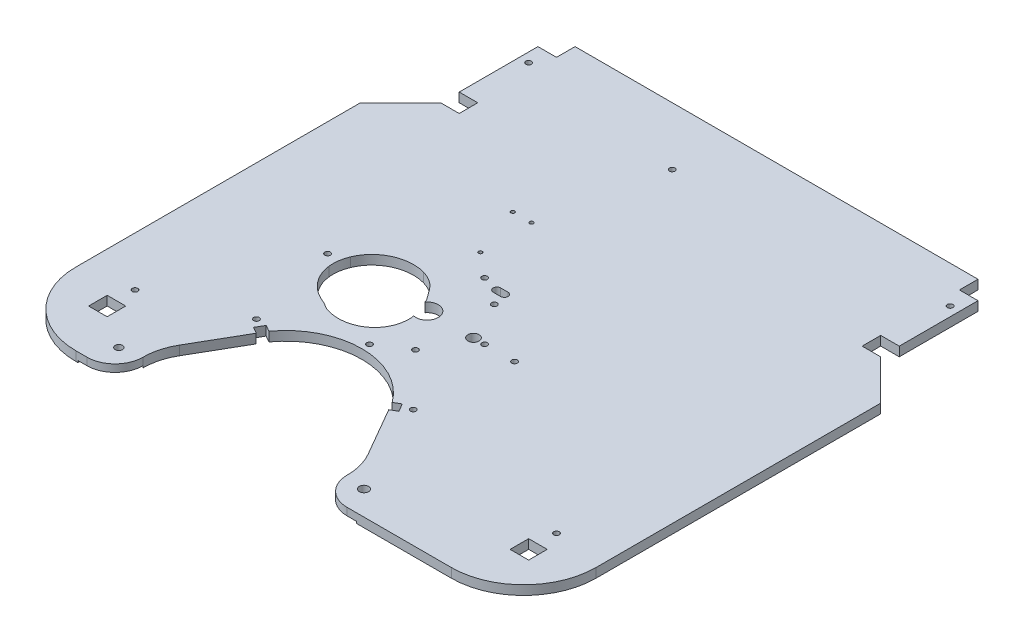
from build123d import *

# Parameters (mm, degrees)
ESQUISSE1_W              = 280.2
ESQUISSE1_H              = 276.282873123
BOSS_EXTRU_1_DEPTH       = 5
ESQUISSE2_R              = 1.5
ENL_V_MAT_EXTRU_2_DEPTH  = 283.344868376
ENL_V_MAT_EXTRU_3_DEPTH  = 283.344868376
ESQUISSE4_R              = 1
ENL_V_MAT_EXTRU_4_DEPTH  = 283.344868514
ESQUISSE5_R              = 1.5
ESQUISSE5_R_2            = 3
ENL_V_MAT_EXTRU_5_DEPTH  = 283.344868514
ESQUISSE6_R              = 6
ENL_V_MAT_EXTRU_6_DEPTH  = 283.344868514
ENL_V_MAT_EXTRU_7_DEPTH  = 283.344868514
ENL_V_MAT_EXTRU_8_DEPTH  = 283.344868514
ENL_V_MAT_EXTRU_9_DEPTH  = 283.344868514
ENL_V_MAT_EXTRU_10_DEPTH = 1
ESQUISSE11_W             = 10
ESQUISSE11_H             = 10
ENL_V_MAT_EXTRU_11_DEPTH = 283.344868514
ESQUISSE12_R             = 2.5
ESQUISSE12_R_2           = 2
ENL_V_MAT_EXTRU_12_DEPTH = 283.344868514
ESQUISSE13_R             = 1.5
ENL_V_MAT_EXTRU_15_DEPTH = 283.344868514


with BuildPart() as part:
    # Esquisse1 → Boss.-Extru.1 (new body)
    with BuildSketch(Plane(origin=(0, 0, 0), x_dir=(1, 0, 0), z_dir=(0, 1, 0))):
        with Locations((0, -106.941436562)):
            Rectangle(ESQUISSE1_W, ESQUISSE1_H)
    extrude(amount=BOSS_EXTRU_1_DEPTH)

    # Esquisse2 → Enlèv. mat.-Extru.2 (cut, through all)
    with BuildSketch(Plane(origin=(0, 0, 0), x_dir=(1, 0, 0), z_dir=(0, 1, 0))):
        with Locations((-67.225778058, -181.665063509)):
            Circle(ESQUISSE2_R)
        with Locations((17.225778058, -181.665063509)):
            Circle(ESQUISSE2_R)
        with BuildLine():
            Line((-58.181549424, -184), (-61.645651039, -182))
            Line((-61.645651039, -182), (-64.145651039, -186.330127019))
            Line((-64.145651039, -186.330127019), (-60.681549424, -188.330127019))
            Line((-60.681549424, -188.330127019), (-75.853895909, -214.609402001))
            ThreePointArc((-75.853895909, -214.609402001), (-78.945508514, -222.073215083), (-80, -230.082873123))
            ThreePointArc((-80, -230.082873123), (-84.393398282, -240.68947484), (-95, -245.082873123))
            Line((-95, -245.082873123), (45, -245.082873123))
            ThreePointArc((45, -245.082873123), (34.393398282, -240.68947484), (30, -230.082873123))
            ThreePointArc((30, -230.082873123), (28.945508514, -222.073215083), (25.853895909, -214.609402001))
            Line((25.853895909, -214.609402001), (10.681549424, -188.330127019))
            Line((10.681549424, -188.330127019), (14.145651039, -186.330127019))
            Line((14.145651039, -186.330127019), (11.645651039, -182))
            Line((11.645651039, -182), (8.181549424, -184))
            ThreePointArc((8.181549424, -184), (-25, -167.082873123), (-58.181549424, -184))
        make_face()
    extrude(amount=ENL_V_MAT_EXTRU_2_DEPTH, mode=Mode.SUBTRACT)

    # Esquisse3 → Enlèv. mat.-Extru.3 (cut, through all)
    with BuildSketch(Plane(origin=(0, 5, 0), x_dir=(1, 0, 0), z_dir=(0, 1, 0))):
        with BuildLine():
            Line((-30.232196293, -127.056876517), (-26.124706917, -139.131217425))
            add(Edge.make_bspline(
                [(-26.124706917, -139.131217425), (-25.973443286, -141.562315427), (-26.240501714, -144.066449507), (-26.974458359, -146.389039833)],
                knots=[0, 0, 0, 0, 1, 1, 1, 1], degree=3))
            add(Edge.make_bspline(
                [(-26.974458359, -146.389039833), (-27.240939918, -147.232315109), (-27.901711614, -148.887186594), (-29.222092456, -151.16859082), (-30.896145941, -153.271950606), (-32.173925278, -154.467879681), (-32.85436264, -155.020953925)],
                knots=[0, 0, 0, 0, 0.25, 0.5, 0.75, 1, 1, 1, 1], degree=3))
            add(Edge.make_bspline(
                [(-32.85436264, -155.020953925), (-34.102216947, -156.035236967), (-36.895257319, -157.732816873), (-39.966969366, -158.683613706), (-41.535872906, -158.982350321)],
                knots=[0, 0, 0, 0, 0.5, 1, 1, 1, 1], degree=3))
            add(Edge.make_bspline(
                [(-41.535872906, -158.982350321), (-44.13944429, -159.478099156), (-46.882867983, -159.47574722), (-49.48692049, -158.982531853)],
                knots=[0, 0, 0, 0, 1, 1, 1, 1], degree=3))
            add(Edge.make_bspline(
                [(-49.48692049, -158.982531853), (-49.973436213, -158.890384314), (-50.941516847, -158.671807697), (-52.005577298, -158.352188131), (-52.710739171, -158.106116095), (-53.049063692, -157.981027978), (-53.432325993, -157.83427396), (-53.839616411, -157.629085383), (-54.162137671, -157.444280488), (-54.493584438, -157.24405871), (-54.822631153, -157.027085358), (-55.019194439, -156.890401704), (-55.119773387, -156.820266925)],
                knots=[0, 0, 0, 0, 0.25, 0.5, 0.5625, 0.625, 0.6875, 0.75, 0.8125, 0.875, 0.9375, 1, 1, 1, 1], degree=3))
            add(Edge.make_bspline(
                [(-55.119773387, -156.820266925), (-55.342584678, -156.664898224), (-55.821161133, -156.320773011), (-56.357830194, -156.028764531), (-57.135810805, -155.694321533), (-58.127753562, -155.272422312), (-59.441462171, -154.713730904), (-60.715247509, -154.070015017), (-61.736091579, -153.463400683), (-62.671055675, -152.853125374), (-64.3254583, -151.704430932), (-66.461253558, -149.797913164), (-68.688909234, -147.123366593), (-71.04573381, -143.184617989), (-72.065572969, -139.797016013), (-72.336044542, -137.516218816)],
                knots=[0, 0, 0, 0, 0.03125, 0.0625, 0.09375, 0.125, 0.1875, 0.25, 0.28125, 0.3125, 0.375, 0.5, 0.625, 0.75, 1, 1, 1, 1], degree=3))
            add(Edge.make_bspline(
                [(-72.336044542, -137.516218816), (-72.538851292, -135.806016663), (-72.497059046, -132.31446777), (-71.577583293, -128.96502082), (-70.925114795, -127.375270768)],
                knots=[0, 0, 0, 0, 0.5, 1, 1, 1, 1], degree=3))
            add(Edge.make_bspline(
                [(-70.925114795, -127.375270768), (-70.413093619, -126.127722888), (-69.152455528, -123.733716988), (-66.576150351, -120.520293649), (-63.491201583, -117.918915096), (-59.929943003, -115.889711454), (-56.128151034, -114.553617023), (-52.09810731, -113.890404675), (-48.046815493, -113.938774256), (-45.377232563, -114.445148274), (-44.081266578, -114.817883607)],
                knots=[0, 0, 0, 0, 0.125, 0.25, 0.375, 0.5, 0.625, 0.75, 0.875, 1, 1, 1, 1], degree=3))
            add(Edge.make_bspline(
                [(-44.081266578, -114.817883607), (-43.14238246, -115.087917919), (-41.310567547, -115.747973194), (-39.103484983, -116.93355719), (-37.482075864, -118.081051527), (-36.310697029, -119.096824351), (-35.307582377, -120.188793074), (-34.695859436, -120.936019919), (-34.39519288, -121.317167086)],
                knots=[0, 0, 0, 0, 0.25, 0.5, 0.625, 0.75, 0.875, 1, 1, 1, 1], degree=3))
            add(Edge.make_bspline(
                [(-34.39519288, -121.317167086), (-33.6647314, -122.243154093), (-32.610141308, -123.682254904), (-31.253536633, -125.564961028), (-30.556455375, -126.553796492), (-30.232196293, -127.056876517)],
                knots=[0, 0, 0, 0, 0.5, 0.75, 1, 1, 1, 1], degree=3))
        make_face()
    extrude(amount=-ENL_V_MAT_EXTRU_3_DEPTH, mode=Mode.SUBTRACT)

    # Esquisse4 → Enlèv. mat.-Extru.4 (cut, through all)
    with BuildSketch(Plane(origin=(0, 5, 0), x_dir=(1, 0, 0), z_dir=(0, 1, 0))):
        with Locations((-48.2, -62.65)):
            Circle(ESQUISSE4_R)
        with Locations((-38.1, -62.65)):
            Circle(ESQUISSE4_R)
        with Locations((-38.1, -90.25)):
            Circle(ESQUISSE4_R)
    extrude(amount=-ENL_V_MAT_EXTRU_4_DEPTH, mode=Mode.SUBTRACT)

    # Esquisse5 → Enlèv. mat.-Extru.5 (cut, through all)
    with BuildSketch(Plane(origin=(0, 5, 0), x_dir=(1, 0, 0), z_dir=(0, 1, 0))):
        with Locations((22.122359024, -132)):
            Circle(ESQUISSE5_R)
        with Locations((-10.050791121, -153.25)):
            Circle(ESQUISSE5_R)
        with Locations((-25, -163)):
            Circle(ESQUISSE5_R)
        with Locations((-10.050791121, -110.75)):
            Circle(ESQUISSE5_R)
        with Locations((-25, -101)):
            Circle(ESQUISSE5_R)
        with Locations((-78.6, -132)):
            Circle(ESQUISSE5_R)
        with Locations((6, -132)):
            Circle(ESQUISSE5_R)
        with Locations((0, -132)):
            Circle(ESQUISSE5_R_2)
    extrude(amount=-ENL_V_MAT_EXTRU_5_DEPTH, mode=Mode.SUBTRACT)

    # Esquisse6 → Enlèv. mat.-Extru.6 (cut, through all)
    with BuildSketch(Plane(origin=(0, 5, 0), x_dir=(1, 0, 0), z_dir=(0, 1, 0))):
        with Locations((-25, -132)):
            Circle(ESQUISSE6_R)
    extrude(amount=-ENL_V_MAT_EXTRU_6_DEPTH, mode=Mode.SUBTRACT)

    # Esquisse7 → Enlèv. mat.-Extru.7 (cut, through all)
    with BuildSketch(Plane(origin=(0, 5, 0), x_dir=(1, 0, 0), z_dir=(0, 1, 0))):
        with BuildLine():
            Line((-16, -101.4), (-12, -101.4))
            ThreePointArc((-12, -101.4), (-10, -103.4), (-12, -105.4))
            Line((-12, -105.4), (-16, -105.4))
            ThreePointArc((-16, -105.4), (-18, -103.4), (-16, -101.4))
        make_face()
    extrude(amount=-ENL_V_MAT_EXTRU_7_DEPTH, mode=Mode.SUBTRACT)

    # Esquisse8 → Enlèv. mat.-Extru.8 (cut, through all)
    with BuildSketch(Plane(origin=(0, 5, 0), x_dir=(1, 0, 0), z_dir=(0, 1, 0))):
        with BuildLine():
            Line((101.1, -245.082873123), (140.1, -245.082873123))
            Line((140.1, -245.082873123), (140.1, -206.082873123))
            ThreePointArc((140.1, -206.082873123), (128.677164466, -233.660037589), (101.1, -245.082873123))
        make_face()
        with BuildLine():
            Line((-140.1, -245.082873123), (-140.1, -206.082873123))
            ThreePointArc((-140.1, -206.082873123), (-128.677164466, -233.660037589), (-101.1, -245.082873123))
            Line((-101.1, -245.082873123), (-140.1, -245.082873123))
        make_face()
    extrude(amount=-ENL_V_MAT_EXTRU_8_DEPTH, mode=Mode.SUBTRACT)

    # Esquisse9 → Enlèv. mat.-Extru.9 (cut, through all)
    with BuildSketch(Plane(origin=(0, 5, 0), x_dir=(1, 0, 0), z_dir=(0, 1, 0))):
        Polygon((-108.5, 21.2), (-118.5, 21.2), (-118.5, -21.2), (-108.5, -21.2), (-108.5, -31.2), (-118.5, -31.2), (-140.1, -52.8), (-140.1, 31.2), (-108.5, 31.2), align=None)
        Polygon((140.1, 31.2), (108.5, 31.2), (108.5, 21.2), (118.5, 21.2), (118.5, -21.2), (108.5, -21.2), (108.5, -31.2), (118.5, -31.2), (140.1, -52.8), align=None)
    extrude(amount=-ENL_V_MAT_EXTRU_9_DEPTH, mode=Mode.SUBTRACT)

    # Esquisse10 → Enlèv. mat.-Extru.10 (cut)
    with BuildSketch(Plane.XZ):
        with BuildLine():
            Line((50, 242.082873123), (50, 245.082873123))
            Line((50, 245.082873123), (45, 245.082873123))
            ThreePointArc((45, 245.082873123), (30.714652713, 234.657679446), (36.286307054, 217.873386842))
            ThreePointArc((36.286307054, 217.873386842), (75.473609251, 99.823862194), (-25, 26.5))
            ThreePointArc((-25, 26.5), (-125.473609251, 99.823862194), (-86.286307054, 217.873386842))
            ThreePointArc((-86.286307054, 217.873386842), (-80.714652713, 234.657679446), (-95, 245.082873123))
            Line((-95, 245.082873123), (-100, 245.082873123))
            Line((-100, 245.082873123), (-100, 242.082873123))
            Line((-100, 242.082873123), (-95, 242.082873123))
            ThreePointArc((-95, 242.082873123), (-83.571722171, 233.742718181), (-88.029045643, 220.315284098))
            ThreePointArc((-88.029045643, 220.315284098), (-128.330678708, 98.90890093), (-25, 23.5))
            ThreePointArc((-25, 23.5), (78.330678708, 98.90890093), (38.029045643, 220.315284098))
            ThreePointArc((38.029045643, 220.315284098), (33.571722171, 233.742718181), (45, 242.082873123))
            Line((45, 242.082873123), (50, 242.082873123))
        make_face()
    extrude(amount=-ENL_V_MAT_EXTRU_10_DEPTH, mode=Mode.SUBTRACT)

    # Esquisse11 → Enlèv. mat.-Extru.11 (cut, through all)
    with BuildSketch(Plane(origin=(0, 5, 0), x_dir=(1, 0, 0), z_dir=(0, 1, 0))):
        with Locations((-113.5, -215.8)):
            Rectangle(ESQUISSE11_W, ESQUISSE11_H)
        with Locations((113.5, -215.8)):
            Rectangle(ESQUISSE11_W, ESQUISSE11_H)
    extrude(amount=-ENL_V_MAT_EXTRU_11_DEPTH, mode=Mode.SUBTRACT)

    # Esquisse12 → Enlèv. mat.-Extru.12 (cut, through all)
    with BuildSketch(Plane(origin=(0, 5, 0), x_dir=(1, 0, 0), z_dir=(0, 1, 0))):
        with Locations((41, -232)):
            Circle(ESQUISSE12_R)
        with Locations((-91, -232)):
            Circle(ESQUISSE12_R_2)
    extrude(amount=-ENL_V_MAT_EXTRU_12_DEPTH, mode=Mode.SUBTRACT)

    # Esquisse13 → Enlèv. mat.-Extru.15 (cut, through all)
    with BuildSketch(Plane(origin=(0, 5, 0), x_dir=(1, 0, 0), z_dir=(0, 1, 0))):
        with Locations((-113.5, -200.8)):
            Circle(ESQUISSE13_R)
        with Locations((-113.5, 11.2)):
            Circle(ESQUISSE13_R)
        with Locations((113.5, 11.2)):
            Circle(ESQUISSE13_R)
        with Locations((113.5, -200.8)):
            Circle(ESQUISSE13_R)
        with Locations((-25, 0)):
            Circle(ESQUISSE13_R)
    extrude(amount=-ENL_V_MAT_EXTRU_15_DEPTH, mode=Mode.SUBTRACT)


solid = part.part
